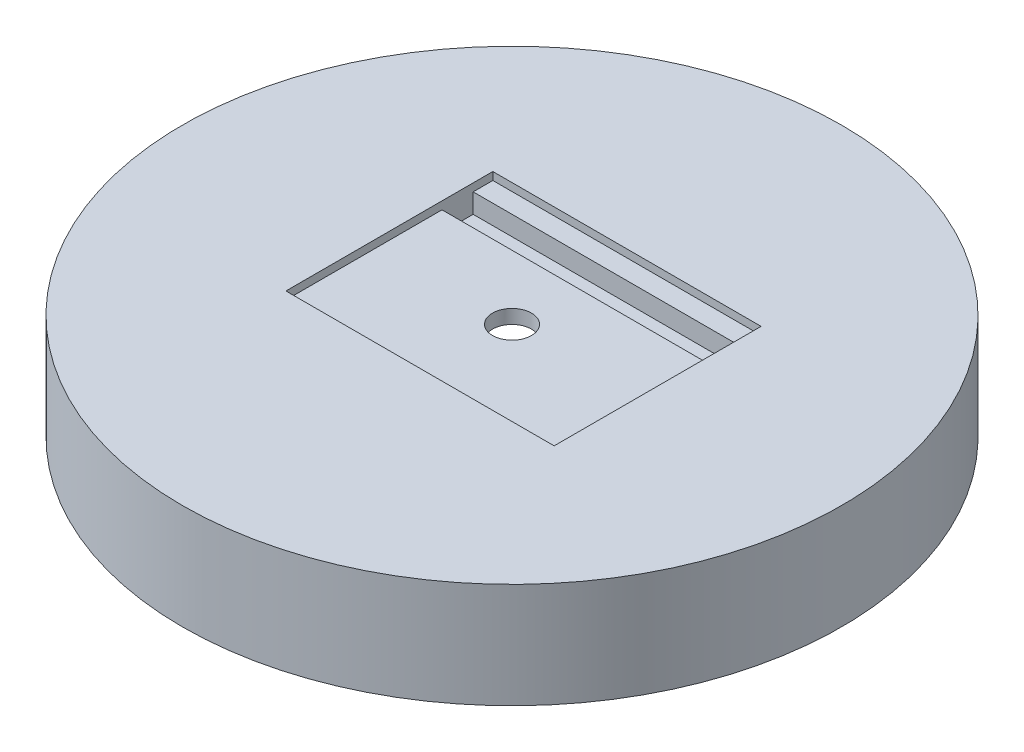
from build123d import *

# Parameters (mm, degrees)
SKETCH5_W          = 17.5
SKETCH5_H          = 13.5
CUT_EXTRUDE1_DEPTH = 6.35
SKETCH6_W          = 17.5
SKETCH6_H          = 2.032
CUT_EXTRUDE2_DEPTH = 10.16


with BuildPart() as part:
    # Sketch3 → Revolve1 (revolve)
    with BuildSketch(Plane.XY):
        Polygon((17.5, 0), (1.27, 5.442857143), (1.27, 6.858), (21.5, 6.858), (21.5, 0), align=None)
    revolve(axis=Axis((0, 0, 0), (0, -1, 0)))

    # Sketch5 → Cut-Extrude1 (cut)
    with BuildSketch(Plane(origin=(0, 12.7, 0), x_dir=(1, 0, 0), z_dir=(0, 1, 0))):
        with Locations((0, 0.75)):
            Rectangle(SKETCH5_W, SKETCH5_H)
    extrude(amount=-CUT_EXTRUDE1_DEPTH, mode=Mode.SUBTRACT)

    # Sketch6 → Cut-Extrude2 (cut)
    with BuildSketch(Plane(origin=(0, 15.24, 0), x_dir=(1, 0, 0), z_dir=(0, 1, 0))):
        with Locations((0, 5.2)):
            Rectangle(SKETCH6_W, SKETCH6_H)
    extrude(amount=-CUT_EXTRUDE2_DEPTH, mode=Mode.SUBTRACT)


solid = part.part
